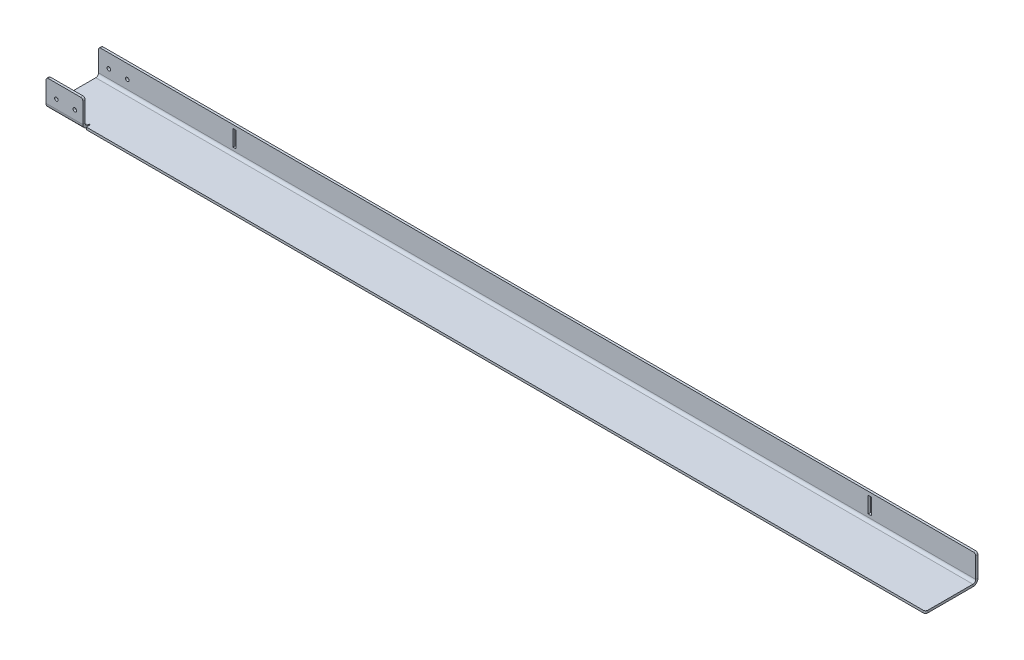
from build123d import *

# Parameters (mm, degrees)
SKETCH1_W                     = 1209.675
SKETCH1_H                     = 72.39
BASE_FLANGE1_DEPTH            = 3.175
EDGE_FLANGE1_STRIP_W          = 20.32
EDGE_FLANGE1_STRIP_H          = 3.175
EDGE_FLANGE1_STRIP_CUT_DEPTH  = 1209.675
EDGE_FLANGE1_DEPTH            = 1209.675
SKETCH10_W                    = 4.191
SKETCH10_H                    = 22.225
CUT_EXTRUDE2_DEPTH            = 611.344430225
EDGE_FLANGE2_STRIP_W          = 20.32
EDGE_FLANGE2_STRIP_H          = 3.175
EDGE_FLANGE2_STRIP_CUT_DEPTH  = 50.8
EDGE_FLANGE2_RELIEF_W         = 21.9075
EDGE_FLANGE2_RELIEF_H         = 1.5875
EDGE_FLANGE2_RELIEF_CUT_DEPTH = 3.175
EDGE_FLANGE2_DEPTH            = 50.8
F_10_0_1935_DIAMETER_HOLE1_D  = 4.9149
FILLET1_R                     = 3.175
LPATTERN1_COUNT               = 2
LPATTERN1_PITCH               = 876.173


# Sheet-metal steps are written as plain solids
with BuildPart() as part:
    # Sketch1 → Base-Flange1 (new body)
    with BuildSketch(Plane(origin=(0, 0, 0), x_dir=(1, 0, 0), z_dir=(0, 1, 0))):
        with Locations((0, -36.195)):
            Rectangle(SKETCH1_W, SKETCH1_H)
    extrude(amount=BASE_FLANGE1_DEPTH)

    # Edge-Flange1 strip (across the edge) → Edge-Flange1 strip cut (cut)
    with BuildSketch(Plane(origin=(604.8375, 3.175, 0), x_dir=(0, 0, 1), z_dir=(-1, 0, 0))):
        with Locations((-3.175, -1.5875)):
            Rectangle(EDGE_FLANGE1_STRIP_W, EDGE_FLANGE1_STRIP_H)
    extrude(amount=EDGE_FLANGE1_STRIP_CUT_DEPTH, mode=Mode.SUBTRACT)

    # Edge-Flange1 section (across the edge) → Edge-Flange1 (add)
    with BuildSketch(Plane(origin=(604.8375, 3.175, 0), x_dir=(0, 0, 1), z_dir=(-1, 0, 0))):
        with BuildLine():
            Line((0, 3.81), (0, 34.925))
            Line((0, 34.925), (3.175, 34.925))
            Line((3.175, 34.925), (3.175, 3.81))
            ThreePointArc((3.175, 3.81), (4.290923164, 1.115923164), (6.985, 0))
            Line((6.985, 0), (6.985, -3.175))
            ThreePointArc((6.985, -3.175), (2.045859133, -1.129140867), (0, 3.81))
        make_face()
    extrude(amount=EDGE_FLANGE1_DEPTH)

    # Sketch10 → Cut-Extrude2 (cut, through all)
    with BuildSketch(Plane(origin=(0, 0, 0), x_dir=(-1, 0, 0), z_dir=(0, 0, -1))):
        with Locations((417.449, 22.225)):
            Rectangle(SKETCH10_W, SKETCH10_H)
    cut_extrude2 = extrude(amount=-CUT_EXTRUDE2_DEPTH, mode=Mode.SUBTRACT)

    # Edge-Flange2 strip (across the edge) → Edge-Flange2 strip cut (cut)
    with BuildSketch(Plane(origin=(-604.8375, 3.175, 72.39), x_dir=(0, 0, -1), z_dir=(1, 0, 0))):
        with Locations((-6.35, -1.5875)):
            Rectangle(EDGE_FLANGE2_STRIP_W, EDGE_FLANGE2_STRIP_H)
    extrude(amount=EDGE_FLANGE2_STRIP_CUT_DEPTH, mode=Mode.SUBTRACT)

    # Edge-Flange2 relief (on the sheet) → Edge-Flange2 relief cut (cut)
    with BuildSketch(Plane(origin=(-604.8375, 3.175, 68.58), x_dir=(0, 0, -1), z_dir=(0, 1, 0))):
        with Locations((-9.36625, -51.59375)):
            Rectangle(EDGE_FLANGE2_RELIEF_W, EDGE_FLANGE2_RELIEF_H)
    extrude(amount=-EDGE_FLANGE2_RELIEF_CUT_DEPTH, mode=Mode.SUBTRACT)

    # Edge-Flange2 section (across the edge) → Edge-Flange2 (add)
    with BuildSketch(Plane(origin=(-604.8375, 3.175, 72.39), x_dir=(0, 0, -1), z_dir=(1, 0, 0))):
        with BuildLine():
            Line((-3.175, 3.81), (-3.175, 34.925))
            Line((-3.175, 34.925), (0, 34.925))
            Line((0, 34.925), (0, 3.81))
            ThreePointArc((0, 3.81), (1.115923164, 1.115923164), (3.81, 0))
            Line((3.81, 0), (3.81, -3.175))
            ThreePointArc((3.81, -3.175), (-1.129140867, -1.129140867), (-3.175, 3.81))
        make_face()
    extrude(amount=EDGE_FLANGE2_DEPTH)

    # #10 (0.1935) Diameter Hole1 (through all)
    with Locations(Plane.XY.offset(75.565)):
        with Locations((-565.15, 19.05), (-590.55, 19.05)):
            Hole(F_10_0_1935_DIAMETER_HOLE1_D / 2)

    # Fillet1
    fillet1_edges = [part.edges().sort_by_distance(p)[0] for p in [
        (-604.8375, 38.1, 73.9775),
        (-554.0375, 38.1, 73.9775),
        (604.8375, 38.1, 1.5875),
        (-604.8375, 38.1, 1.5875),
        (604.8375, 1.5875, 72.39),
    ]]
    fillet(fillet1_edges, radius=FILLET1_R)

    # LPattern1: Cut-Extrude2 ×2
    with Locations(*[(i * LPATTERN1_PITCH, 0, 0) for i in range(1, LPATTERN1_COUNT)]):
        add(cut_extrude2, mode=Mode.SUBTRACT)


solid = part.part
